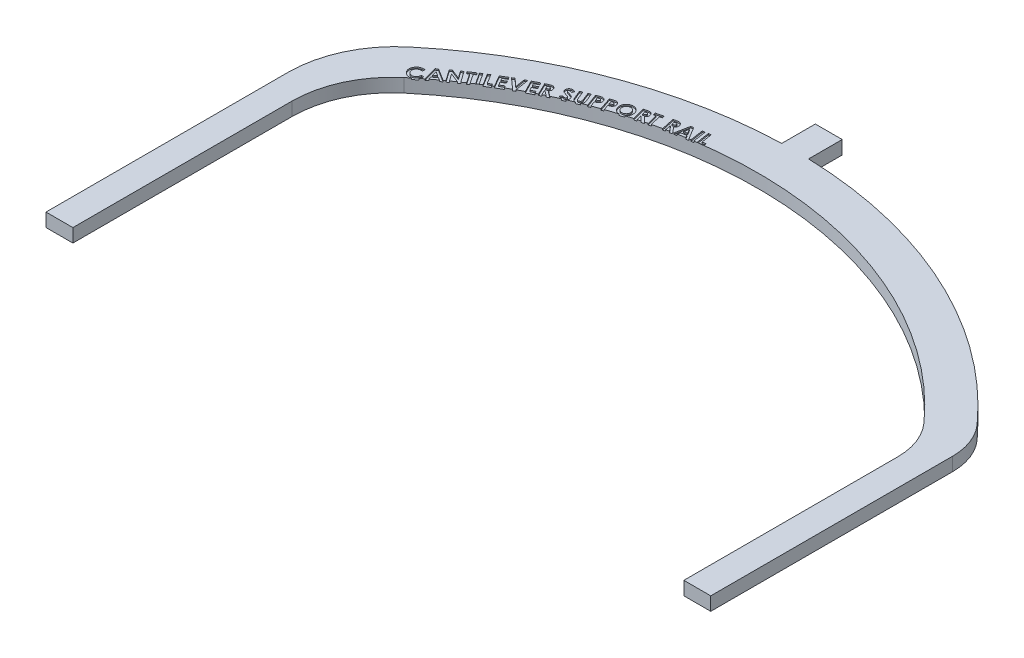
from build123d import *

# Parameters (mm, degrees)
BOSS_EXTRUDE1_DEPTH = 12.7
CUT_EXTRUDE1_DEPTH  = 1.27


with BuildPart() as part:
    # Sketch1 → Boss-Extrude1 (new body)
    with BuildSketch(Plane(origin=(0, 0, 0), x_dir=(1, 0, 0), z_dir=(0, 1, 0))):
        with BuildLine():
            Line((2401.841209368, 798.332676121), (2401.841209368, 830.082676121))
            Line((2401.841209368, 830.082676121), (2427.241209368, 830.082676121))
            Line((2427.241209368, 830.082676121), (2427.241209368, 798.332676121))
            ThreePointArc((2427.241209368, 798.332676121), (2589.753421821, 759.885508739), (2724.105617869, 660.699364075))
            ThreePointArc((2724.105617869, 660.699364075), (2734.766702642, 643.302054903), (2738.485044695, 623.239676495))
            Line((2738.485044695, 623.239676495), (2738.485044695, 394.639676495))
            Line((2738.485044695, 394.639676495), (2713.085044695, 394.639676495))
            Line((2713.085044695, 394.639676495), (2713.085044695, 596.771971598))
            ThreePointArc((2713.085044695, 596.771971598), (2709.101332249, 618.266160516), (2697.679387875, 636.905079713))
            ThreePointArc((2697.679387875, 636.905079713), (2441.118425865, 762.03822184), (2169.639130078, 673.829251519))
            ThreePointArc((2169.639130078, 673.829251519), (2144.741094815, 641.381500231), (2135.888823821, 601.451486183))
            Line((2135.888823821, 601.451486183), (2135.888823821, 394.639676495))
            Line((2135.888823821, 394.639676495), (2110.488823821, 394.639676495))
            Line((2110.488823821, 394.639676495), (2110.488823821, 623.239676495))
            ThreePointArc((2110.488823821, 623.239676495), (2120.007952658, 666.177691888), (2146.781602677, 701.069791916))
            ThreePointArc((2146.781602677, 701.069791916), (2266.118115116, 771.187102684), (2401.841209368, 798.332676121))
        make_face()
    extrude(amount=BOSS_EXTRUDE1_DEPTH)

    # Sketch2 → Cut-Extrude1 (cut)
    # profile 1 of 21: a face of its own
    with BuildSketch(Plane(origin=(0, 12.7, 0), x_dir=(1, 0, 0), z_dir=(0, 1, 0))):
        with BuildLine():
            Line((2173.231357642, 690.146919788), (2172.936245462, 687.839447833))
            add(Edge.make_bspline(
                [(2172.936245462, 687.839447833), (2172.733829883, 687.861838727), (2172.339125999, 687.905500251), (2171.754563692, 687.907062772), (2171.195838976, 687.856646991), (2170.660754262, 687.756005462), (2170.15177426, 687.599610813), (2169.667828827, 687.392491824), (2169.207758032, 687.133322769), (2168.927838013, 686.919385225), (2168.786866456, 686.811643346)],
                knots=[0, 0, 0, 0, 1.110178995, 2.164813411, 3.182023249, 4.16630837, 5.129066433, 6.080198176, 7.033161496, 8, 8, 8, 8], degree=3))
            add(Edge.make_bspline(
                [(2168.786866456, 686.811643346), (2168.673884602, 686.715313189), (2168.451734466, 686.525904389), (2168.155250513, 686.210383614), (2167.897135038, 685.876300537), (2167.677329406, 685.523433064), (2167.494155266, 685.15265157), (2167.355797235, 684.760748977), (2167.249945484, 684.351525199), (2167.185477052, 683.927951479), (2167.158601675, 683.50029347), (2167.178010706, 683.078660162), (2167.23233011, 682.666573951), (2167.332238923, 682.26466749), (2167.476958405, 681.874708911), (2167.657056303, 681.493237855), (2167.883243795, 681.124405507), (2168.060539729, 680.892625586), (2168.150848828, 680.774564019)],
                knots=[0, 0, 0, 0, 1.05173237, 2.067964735, 3.062219871, 4.039580069, 5.010003154, 5.987252451, 6.980034845, 8.001851189, 9.019433604, 10.012088621, 10.988801714, 11.961158804, 12.940457753, 13.932530269, 14.946894476, 16, 16, 16, 16], degree=3))
            add(Edge.make_bspline(
                [(2168.150848828, 680.774564019), (2168.217902851, 680.695008865), (2168.349908253, 680.538393207), (2168.559333978, 680.317930309), (2168.778314473, 680.117153414), (2169.004698622, 679.934118775), (2169.238068746, 679.767235815), (2169.478491441, 679.616790906), (2169.729136534, 679.487039264), (2169.986025279, 679.375461172), (2170.248126077, 679.280176124), (2170.514879828, 679.207763296), (2170.784045793, 679.150813217), (2171.055130396, 679.112527878), (2171.329816293, 679.094364735), (2171.606053493, 679.097909504), (2171.885784451, 679.117652151), (2172.166093484, 679.158863326), (2172.446504805, 679.217344051), (2172.72277069, 679.293386378), (2172.993897761, 679.386681227), (2173.256283125, 679.504060025), (2173.515934158, 679.631958964), (2173.769271116, 679.780721738), (2174.015450788, 679.948830458), (2174.174113183, 680.071590892), (2174.254073988, 680.13345825)],
                knots=[0, 0, 0, 0, 1.088887861, 2.143630938, 3.180177357, 4.196304021, 5.188936652, 6.181569282, 7.162183593, 8.140062349, 9.111514668, 10.07841455, 11.030658299, 11.989703728, 12.941492303, 13.909043844, 14.879157041, 15.874603407, 16.872105503, 17.875592508, 18.872146332, 19.869845871, 20.882088245, 21.900538373, 22.94193806, 24, 24, 24, 24], degree=3))
            add(Edge.make_bspline(
                [(2174.254073988, 680.13345825), (2174.384533599, 680.24536423), (2174.640813497, 680.46519666), (2174.978057679, 680.833842583), (2175.264388979, 681.22648174), (2175.468353681, 681.572719147), (2175.604260019, 681.869841703), (2175.697620628, 682.111386604), (2175.784251951, 682.372002862), (2175.863106826, 682.651123852), (2175.93083503, 682.949485723), (2175.991853861, 683.265961959), (2176.046158804, 683.601762674), (2176.072355205, 683.833256391), (2176.085804757, 683.952108089)],
                knots=[0, 0, 0, 0, 1.416939689, 2.783491055, 4.109936354, 5.420178514, 6.090036538, 6.803239493, 7.555382972, 8.354867369, 9.194857702, 10.078404074, 11.013429213, 12, 12, 12, 12], degree=3))
            Line((2176.085804757, 683.952108089), (2178.423805558, 683.654451839))
            add(Edge.make_bspline(
                [(2178.423805558, 683.654451839), (2178.403695599, 683.496563489), (2178.364243143, 683.186812324), (2178.28793995, 682.735329067), (2178.19954209, 682.307433183), (2178.097258805, 681.903502355), (2177.983447966, 681.522111388), (2177.857042292, 681.163383639), (2177.716782308, 680.828742225), (2177.563063644, 680.515197059), (2177.392319713, 680.217219626), (2177.207400984, 679.926339126), (2176.999883703, 679.643381171), (2176.773134999, 679.36646949), (2176.528405315, 679.094221724), (2176.266667153, 678.826200284), (2175.983476334, 678.566941007), (2175.784572055, 678.401019159), (2175.683841616, 678.316991903)],
                knots=[0, 0, 0, 0, 1.235582976, 2.424012065, 3.5538245, 4.626869192, 5.657909355, 6.64285172, 7.57824923, 8.473344072, 9.352017348, 10.243254057, 11.147934228, 12.074391944, 13.020822557, 13.989188457, 14.981671329, 16, 16, 16, 16], degree=3))
            add(Edge.make_bspline(
                [(2175.683841616, 678.316991903), (2175.493934769, 678.170000803), (2175.121147608, 677.881457257), (2174.528035856, 677.519124507), (2173.92743181, 677.217238281), (2173.313670548, 676.984175585), (2172.68867562, 676.818607664), (2172.052778947, 676.717039269), (2171.40631865, 676.689024784), (2170.755144059, 676.720601114), (2170.111792041, 676.820096439), (2169.486502136, 676.980333127), (2168.885837311, 677.205063303), (2168.311041628, 677.49477222), (2167.761500059, 677.845396139), (2167.237786248, 678.25796161), (2166.738156056, 678.733084585), (2166.435517037, 679.089165254), (2166.280957001, 679.271018346)],
                knots=[0, 0, 0, 0, 1.086400669, 2.132604632, 3.140358809, 4.125687137, 5.098742261, 6.062476536, 7.034796858, 8.022642088, 9.009136309, 9.976533535, 10.939839559, 11.906390961, 12.885063744, 13.885715185, 14.920218747, 16, 16, 16, 16], degree=3))
            add(Edge.make_bspline(
                [(2166.280957001, 679.271018346), (2166.185362233, 679.393750726), (2165.996667813, 679.636012054), (2165.742015032, 680.014286764), (2165.514426399, 680.398294074), (2165.318160953, 680.79031025), (2165.153536738, 681.189113762), (2165.011382537, 681.591535073), (2164.901831229, 682.002407783), (2164.824156191, 682.419325745), (2164.771895365, 682.839873295), (2164.752817073, 683.262460778), (2164.759212568, 683.685828679), (2164.798791504, 684.108955219), (2164.864060244, 684.532522462), (2164.962214193, 684.955294391), (2165.086885008, 685.379584807), (2165.241940079, 685.801385532), (2165.421033792, 686.216353906), (2165.624333014, 686.617479859), (2165.854964463, 686.999561425), (2166.106374232, 687.366400413), (2166.381664848, 687.715823894), (2166.681177143, 688.046782379), (2167.000703303, 688.364839828), (2167.232643604, 688.558534767), (2167.349466616, 688.656094468)],
                knots=[0, 0, 0, 0, 1.062251212, 2.096776656, 3.11195735, 4.109185054, 5.088010639, 6.056985029, 7.022161103, 7.988847885, 8.951500846, 9.914066686, 10.875673664, 11.841040878, 12.814212487, 13.800531958, 14.802993609, 15.832741368, 16.867801706, 17.888370809, 18.901533809, 19.913653309, 20.924047849, 21.937028728, 22.960928664, 24, 24, 24, 24], degree=3))
            add(Edge.make_bspline(
                [(2167.349466616, 688.656094468), (2167.45215523, 688.735995545), (2167.656409232, 688.894923729), (2167.976193019, 689.114677747), (2168.305742429, 689.315132904), (2168.646941016, 689.496475504), (2168.996212257, 689.661553159), (2169.356745992, 689.808229236), (2169.728428661, 689.930417028), (2170.106958588, 690.041503299), (2170.491735819, 690.129986131), (2170.880034482, 690.196045565), (2171.269795608, 690.241756037), (2171.660403097, 690.2680247), (2172.051959726, 690.269568285), (2172.444362038, 690.252447002), (2172.838466844, 690.211886713), (2173.100108572, 690.168622634), (2173.231357642, 690.146919788)],
                knots=[0, 0, 0, 0, 0.997702735, 1.984492435, 2.973850679, 3.954383721, 4.946474413, 5.935597484, 6.937193048, 7.945795584, 8.960231564, 9.963156526, 10.965089882, 11.968773709, 12.96386568, 13.966474278, 14.979909047, 16, 16, 16, 16], degree=3))
        make_face()
    # profile 2 of 21: a face of its own
    with BuildSketch(Plane(origin=(0, 12.7, 0), x_dir=(1, 0, 0), z_dir=(0, 1, 0))):
        Polygon((2176.906198846, 695.662568898), (2178.847324647, 697.125409443), (2190.295641955, 689.984203513), (2188.306178814, 688.485745981), (2185.960545801, 689.963850949), (2181.856960064, 686.870261206), (2182.597284583, 684.183722744), (2180.607821442, 682.682721142), align=None)
        Polygon((2179.90056984, 693.73925159), (2181.159884743, 689.276951911), (2183.833702852, 691.291855757), align=None, mode=Mode.SUBTRACT)
    # profile 3 of 21: a face of its own
    with BuildSketch(Plane(origin=(0, 12.7, 0), x_dir=(1, 0, 0), z_dir=(0, 1, 0))):
        Polygon((2184.654808618, 701.383039031), (2186.529788586, 702.695779415), (2195.685898361, 699.014509383), (2190.943750925, 705.786825088), (2192.90268522, 707.158079095), (2200.110036983, 696.867313871), (2198.227424804, 695.549485345), (2189.091667592, 699.215490954), (2193.821094675, 692.463527813), (2191.862160381, 691.092273806), align=None)
    # profile 4 of 21: a face of its own
    with BuildSketch(Plane(origin=(0, 12.7, 0), x_dir=(1, 0, 0), z_dir=(0, 1, 0))):
        Polygon((2194.549905881, 708.368662739), (2200.365651073, 712.217841425), (2201.670759246, 710.243642707), (2199.75507415, 708.974151521), (2205.413086971, 700.423530527), (2203.380374631, 699.080261297), (2197.72236181, 707.63088229), (2195.855014054, 706.394464021), align=None)
    # profile 5 of 21: a face of its own
    with BuildSketch(Plane(origin=(0, 12.7, 0), x_dir=(1, 0, 0), z_dir=(0, 1, 0))):
        Polygon((2201.554472328, 713.000179544), (2203.543935469, 714.31800807), (2210.507056462, 703.793188359), (2208.517593321, 702.475359833), align=None)
    # profile 6 of 21: a face of its own
    with BuildSketch(Plane(origin=(0, 12.7, 0), x_dir=(1, 0, 0), z_dir=(0, 1, 0))):
        Polygon((2206.187437416, 715.918425383), (2208.235414179, 717.177740287), (2213.6517403, 708.372712242), (2216.635935012, 710.209531152), (2217.836736294, 708.255684998), (2212.80456482, 705.159551184), align=None)
    # profile 7 of 21: a face of its own
    with BuildSketch(Plane(origin=(0, 12.7, 0), x_dir=(1, 0, 0), z_dir=(0, 1, 0))):
        Polygon((2213.126965041, 720.105756234), (2219.064825618, 723.575868413), (2220.247818407, 721.550788285), (2216.365566804, 719.281477387), (2217.515486676, 717.314910881), (2221.397738278, 719.584221778), (2222.560378503, 717.594758637), (2218.6781269, 715.32544774), (2220.349581227, 712.463368413), (2224.23183283, 714.732679311), (2225.419913759, 712.699966971), (2219.482053182, 709.229854791), align=None)
    # profile 8 of 21: a face of its own
    with BuildSketch(Plane(origin=(0, 12.7, 0), x_dir=(1, 0, 0), z_dir=(0, 1, 0))):
        Polygon((2220.444068576, 724.444758281), (2222.619248865, 725.635383281), (2229.735014089, 719.272662928), (2228.246732839, 728.716252672), (2230.421913128, 729.906877672), (2232.500418737, 716.606477031), (2230.460074185, 715.489630076), align=None)
    # profile 9 of 21: a face of its own
    with BuildSketch(Plane(origin=(0, 12.7, 0), x_dir=(1, 0, 0), z_dir=(0, 1, 0))):
        Polygon((2232.500007918, 730.933842662), (2238.628673783, 734.070681605), (2239.697183399, 731.979455643), (2235.690272341, 729.92893481), (2236.730797181, 727.898766541), (2240.737708238, 729.949287374), (2241.78840936, 727.89622247), (2237.781498302, 725.845701637), (2239.292676187, 722.892035771), (2243.299587245, 724.942556605), (2244.373185001, 722.843698432), (2238.244519136, 719.706859489), align=None)
    # profile 10 of 21: a face of its own
    with BuildSketch(Plane(origin=(0, 12.7, 0), x_dir=(1, 0, 0), z_dir=(0, 1, 0))):
        with BuildLine():
            Line((2241.080459505, 735.237166574), (2243.370122967, 736.333660965))
            add(Edge.make_bspline(
                [(2243.370122967, 736.333660965), (2243.521596616, 736.404742649), (2243.813694627, 736.541814796), (2244.24057524, 736.728493413), (2244.640030071, 736.885375399), (2245.008944955, 737.020088982), (2245.349884412, 737.123688975), (2245.660804624, 737.205117451), (2245.94408816, 737.256579203), (2246.281303991, 737.291533785), (2246.682211813, 737.279459402), (2247.149104113, 737.193164256), (2247.601361749, 737.026129075), (2247.961447872, 736.829978805), (2248.236497085, 736.638656486), (2248.435339251, 736.477852329), (2248.624780987, 736.301699903), (2248.802353211, 736.108491173), (2248.96883593, 735.898328248), (2249.123039171, 735.671445097), (2249.269417256, 735.430342919), (2249.354135855, 735.259869652), (2249.397026011, 735.173564812)],
                knots=[0, 0, 0, 0, 1.421347431, 2.740890973, 3.956872945, 5.066552961, 6.076028076, 6.982812744, 7.795303958, 8.519270897, 9.859650626, 11.1863324, 12.535414293, 13.937647829, 14.657048696, 15.379329193, 16.108189666, 16.852514192, 17.606295346, 18.383565237, 19.181653835, 20, 20, 20, 20], degree=3))
            add(Edge.make_bspline(
                [(2249.397026011, 735.173564812), (2249.438788397, 735.081589289), (2249.520934647, 734.900674232), (2249.623954097, 734.626086595), (2249.69922723, 734.353096072), (2249.755785888, 734.084689501), (2249.793497255, 733.819551666), (2249.801816649, 733.557222859), (2249.793140098, 733.29842478), (2249.758745654, 733.044207717), (2249.706684482, 732.79228466), (2249.625575723, 732.545653862), (2249.526743624, 732.30012105), (2249.404343221, 732.058334812), (2249.257985896, 731.820724509), (2249.089159251, 731.586545465), (2248.899089084, 731.35426471), (2248.757032102, 731.208046086), (2248.684686268, 731.133580837)],
                knots=[0, 0, 0, 0, 1.09685938, 2.157512906, 3.18092885, 4.168924605, 5.13535234, 6.084646377, 7.015535552, 7.94423547, 8.867255773, 9.8050891, 10.759373358, 11.739612572, 12.744166522, 13.786916756, 14.872935688, 16, 16, 16, 16], degree=3))
            Line((2248.684686268, 731.133580837), (2253.785547646, 727.37598869))
            Line((2253.785547646, 727.37598869), (2251.427194281, 726.246421382))
            Line((2251.427194281, 726.246421382), (2246.570563672, 729.825928594))
            Line((2246.570563672, 729.825928594), (2246.372126172, 729.729253914))
            Line((2246.372126172, 729.729253914), (2248.674509986, 724.926048786))
            Line((2248.674509986, 724.926048786), (2246.51459412, 723.893156158))
            Line((2246.51459412, 723.893156158), (2241.080459505, 735.237166574))
        make_face()
        with BuildLine():
            Line((2245.364674249, 731.835744299), (2246.041397005, 732.161385324))
            add(Edge.make_bspline(
                [(2246.041397005, 732.161385324), (2246.12399847, 732.202278257), (2246.282124351, 732.280560537), (2246.504043654, 732.403545713), (2246.70361036, 732.522529371), (2246.879485564, 732.641166557), (2247.029976917, 732.760410934), (2247.15549091, 732.878194193), (2247.2597128, 732.991989344), (2247.361470853, 733.144328768), (2247.443103629, 733.351256471), (2247.467715974, 733.621361438), (2247.417487933, 733.910493433), (2247.337994876, 734.097150465), (2247.295623768, 734.196641735)],
                knots=[0, 0, 0, 0, 1.204461837, 2.305728933, 3.315037427, 4.240341522, 5.076376077, 5.821267787, 6.488569286, 7.087989011, 8.207619199, 9.354564099, 10.589939122, 12, 12, 12, 12], degree=3))
            add(Edge.make_bspline(
                [(2247.295623768, 734.196641735), (2247.265211333, 734.255415065), (2247.205590613, 734.370634655), (2247.087015469, 734.521505729), (2246.950168712, 734.648163402), (2246.797164019, 734.750206034), (2246.631132419, 734.826184556), (2246.457365694, 734.87821129), (2246.275317291, 734.900976598), (2246.117705743, 734.897152855), (2245.982233772, 734.875976156), (2245.864026322, 734.850140041), (2245.730605282, 734.812052629), (2245.582281499, 734.760354774), (2245.420059503, 734.695881796), (2245.241326674, 734.622668085), (2245.048646741, 734.535371622), (2244.915162263, 734.473221511), (2244.845683864, 734.440872504)],
                knots=[0, 0, 0, 0, 1.126759185, 2.208905474, 3.252969622, 4.296031307, 5.331543593, 6.356801521, 7.377662472, 8.448438402, 9.033497815, 9.714413281, 10.511152342, 11.398580344, 12.392440594, 13.488419245, 14.692727319, 16, 16, 16, 16], degree=3))
            Line((2244.845683864, 734.440872504), (2244.252915435, 734.155936606))
            Line((2244.252915435, 734.155936606), (2245.364674249, 731.835744299))
        make_face(mode=Mode.SUBTRACT)
    # profile 11 of 21: a face of its own
    with BuildSketch(Plane(origin=(0, 12.7, 0), x_dir=(1, 0, 0), z_dir=(0, 1, 0))):
        with BuildLine():
            Line((2261.827149588, 742.866348255), (2260.822241735, 740.721696812))
            add(Edge.make_bspline(
                [(2260.822241735, 740.721696812), (2260.711416613, 740.786578794), (2260.498342315, 740.911322016), (2260.173884064, 741.056896306), (2259.867316149, 741.172631464), (2259.574628363, 741.247321642), (2259.296967605, 741.283923764), (2259.033990716, 741.286146652), (2258.785013279, 741.246639999), (2258.631073308, 741.189756122), (2258.555474908, 741.161821011)],
                knots=[0, 0, 0, 0, 1.285923329, 2.472338456, 3.558439413, 4.566258642, 5.491680341, 6.358437637, 7.193844932, 8, 8, 8, 8], degree=3))
            add(Edge.make_bspline(
                [(2258.555474908, 741.161821011), (2258.487229893, 741.12925739), (2258.355957321, 741.066619697), (2258.185207907, 740.939897611), (2258.047318321, 740.792316011), (2257.943793353, 740.627900869), (2257.875137149, 740.457566129), (2257.843207563, 740.29010581), (2257.844292906, 740.127329201), (2257.880868364, 740.028235752), (2257.899104716, 739.978828223)],
                knots=[0, 0, 0, 0, 1.211194244, 2.329790441, 3.388949082, 4.434735749, 5.430358932, 6.316451936, 7.160590829, 8, 8, 8, 8], degree=3))
            add(Edge.make_bspline(
                [(2257.899104716, 739.978828223), (2257.921984687, 739.931973085), (2257.967717209, 739.838318963), (2258.068430063, 739.715313624), (2258.188100076, 739.603696404), (2258.282938813, 739.545609442), (2258.331596703, 739.515807389)],
                knots=[0, 0, 0, 0, 0.967791811, 1.93442374, 2.940237024, 4, 4, 4, 4], degree=3))
            add(Edge.make_bspline(
                [(2258.331596703, 739.515807389), (2258.373786052, 739.494166294), (2258.471074111, 739.444262227), (2258.64266764, 739.371176125), (2258.860265669, 739.29141268), (2259.120425135, 739.197565676), (2259.424746421, 739.092800991), (2259.773428145, 738.978661874), (2260.167083734, 738.854489498), (2260.444807613, 738.769340872), (2260.590731318, 738.72460146)],
                knots=[0, 0, 0, 0, 0.474857838, 1.09501563, 1.86652153, 2.796195678, 3.865357899, 5.0902776, 6.471152436, 8, 8, 8, 8], degree=3))
            add(Edge.make_bspline(
                [(2260.590731318, 738.72460146), (2260.727230273, 738.683788501), (2260.985831121, 738.60646728), (2261.353891497, 738.498218367), (2261.678032904, 738.395981404), (2261.960965864, 738.306016056), (2262.20391774, 738.231813595), (2262.403747787, 738.161378403), (2262.564369913, 738.107766833), (2262.65579055, 738.071105388), (2262.694677632, 738.055510915)],
                knots=[0, 0, 0, 0, 1.548386444, 2.933458709, 4.169421886, 5.242096298, 6.160275906, 6.929723018, 7.544742302, 8, 8, 8, 8], degree=3))
            add(Edge.make_bspline(
                [(2262.694677632, 738.055510915), (2262.847531369, 737.99080805), (2263.14017939, 737.866930377), (2263.544794401, 737.652295841), (2263.897606397, 737.424647044), (2264.202472494, 737.17844659), (2264.465878592, 736.91002489), (2264.695394327, 736.614647053), (2264.899624043, 736.292543805), (2265.008067094, 736.059754841), (2265.06320728, 735.941388319)],
                knots=[0, 0, 0, 0, 1.218740014, 2.333353836, 3.359597961, 4.29837092, 5.20574517, 6.115361567, 7.041715329, 8, 8, 8, 8], degree=3))
            add(Edge.make_bspline(
                [(2265.06320728, 735.941388319), (2265.110189464, 735.823405354), (2265.202179297, 735.592397932), (2265.303468971, 735.23854715), (2265.361145077, 734.885854883), (2265.384295331, 734.535708192), (2265.373421965, 734.187321658), (2265.317066878, 733.841646725), (2265.229405569, 733.497412697), (2265.100462086, 733.160090828), (2264.942413277, 732.832196327), (2264.747790568, 732.524729318), (2264.52502038, 732.236387311), (2264.268707477, 731.970814143), (2263.979882397, 731.726463154), (2263.6601419, 731.502641589), (2263.311354721, 731.297100185), (2263.061314026, 731.183424942), (2262.933820261, 731.125462838)],
                knots=[0, 0, 0, 0, 1.031518925, 2.019685862, 2.983724988, 3.929791433, 4.867565412, 5.809003127, 6.770008387, 7.749100081, 8.738347573, 9.722952322, 10.700199419, 11.694378456, 12.71609211, 13.769474433, 14.86267272, 16, 16, 16, 16], degree=3))
            add(Edge.make_bspline(
                [(2262.933820261, 731.125462838), (2262.831737305, 731.083376031), (2262.629957829, 731.000186296), (2262.3229934, 730.9013001), (2262.017382491, 730.827950813), (2261.714437805, 730.77214891), (2261.412157953, 730.74648514), (2261.112082406, 730.736506311), (2260.814281812, 730.755417724), (2260.517642982, 730.796648637), (2260.220744179, 730.858988277), (2259.925199495, 730.953450887), (2259.626866627, 731.066808502), (2259.328330625, 731.208570249), (2259.028032067, 731.37362276), (2258.727445261, 731.566249649), (2258.424115142, 731.781517348), (2258.228072462, 731.941773197), (2258.128071062, 732.023519729)],
                knots=[0, 0, 0, 0, 1.021323989, 2.018772067, 2.979758655, 3.927847242, 4.865489691, 5.78376166, 6.70337339, 7.622114498, 8.553135538, 9.506081333, 10.489607957, 11.50394654, 12.560932203, 13.657928141, 14.805308807, 16, 16, 16, 16], degree=3))
            Line((2258.128071062, 732.023519729), (2259.491692857, 733.941748896))
            add(Edge.make_bspline(
                [(2259.491692857, 733.941748896), (2259.613325652, 733.850809314), (2259.846589849, 733.67640776), (2260.202741916, 733.455962147), (2260.546697242, 733.287836551), (2260.879236239, 733.173956064), (2261.198229002, 733.106601634), (2261.506789088, 733.096739696), (2261.803590713, 733.134191226), (2261.98755494, 733.202888556), (2262.079012568, 733.237041364)],
                knots=[0, 0, 0, 0, 1.293882523, 2.481374106, 3.564275724, 4.549349188, 5.470662853, 6.331206692, 7.170361108, 8, 8, 8, 8], degree=3))
            add(Edge.make_bspline(
                [(2262.079012568, 733.237041364), (2262.169100093, 733.280510166), (2262.343272625, 733.364551451), (2262.568088937, 733.540379325), (2262.755554392, 733.742197815), (2262.893133466, 733.97421754), (2262.988458922, 734.215595291), (2263.031963966, 734.458107381), (2263.017933893, 734.695222056), (2262.967002763, 734.840635307), (2262.941452472, 734.913583832)],
                knots=[0, 0, 0, 0, 1.147907326, 2.219329753, 3.262250237, 4.299725102, 5.303574411, 6.233938217, 7.11403121, 8, 8, 8, 8], degree=3))
            add(Edge.make_bspline(
                [(2262.941452472, 734.913583832), (2262.909901594, 734.977793177), (2262.84554724, 735.108761036), (2262.70119003, 735.282109128), (2262.521511845, 735.438755487), (2262.34399396, 735.557219317), (2262.173129112, 735.646291606), (2262.016173287, 735.719469569), (2261.831977895, 735.79579141), (2261.620585875, 735.874403387), (2261.380760594, 735.95482855), (2261.114102418, 736.042071963), (2260.819125836, 736.129749077), (2260.613648067, 736.18993353), (2260.506776991, 736.221236075)],
                knots=[0, 0, 0, 0, 0.90164922, 1.839094721, 2.826266732, 3.908381705, 4.526918894, 5.260585068, 6.096646716, 7.046329418, 8.110673762, 9.293674922, 10.592412834, 12, 12, 12, 12], degree=3))
            add(Edge.make_bspline(
                [(2260.506776991, 736.221236075), (2260.30218086, 736.279841337), (2259.908058028, 736.392735317), (2259.344509419, 736.567297293), (2258.833123696, 736.739948293), (2258.373685066, 736.908732099), (2257.964009839, 737.068779546), (2257.607325665, 737.229872332), (2257.299904013, 737.383019336), (2257.040754533, 737.538610601), (2256.815154907, 737.695705251), (2256.61293, 737.85818504), (2256.425675037, 738.026062604), (2256.257344017, 738.202126413), (2256.106177996, 738.385461522), (2255.974963582, 738.577413795), (2255.854544732, 738.77346838), (2255.791233396, 738.912138156), (2255.759541414, 738.981552582)],
                knots=[0, 0, 0, 0, 1.800203091, 3.467813079, 4.989914488, 6.365161938, 7.607959434, 8.709212944, 9.674836401, 10.511375378, 11.263576701, 11.998477362, 12.704415329, 13.389339833, 14.057070021, 14.711726029, 15.355124095, 16, 16, 16, 16], degree=3))
            add(Edge.make_bspline(
                [(2255.759541414, 738.981552582), (2255.720376107, 739.081818596), (2255.643171155, 739.279468851), (2255.560577809, 739.584246425), (2255.514926514, 739.890801057), (2255.502993012, 740.198553933), (2255.51937448, 740.508364804), (2255.574800057, 740.820106335), (2255.661196704, 741.133795371), (2255.781797688, 741.444491551), (2255.925587044, 741.748256209), (2256.103606376, 742.030943595), (2256.302395222, 742.295086133), (2256.526778576, 742.537920519), (2256.778115093, 742.756673025), (2257.052308049, 742.956986124), (2257.352031282, 743.135507677), (2257.566546107, 743.233785154), (2257.675226511, 743.283575819)],
                knots=[0, 0, 0, 0, 0.985718607, 1.943106389, 2.885849543, 3.818971467, 4.760625522, 5.722416556, 6.713874654, 7.736884896, 8.772386713, 9.787816365, 10.791617493, 11.797701083, 12.810690582, 13.839437623, 14.905386656, 16, 16, 16, 16], degree=3))
            add(Edge.make_bspline(
                [(2257.675226511, 743.283575819), (2257.820679741, 743.340864037), (2258.109668394, 743.454685126), (2258.564778166, 743.55665257), (2259.027991297, 743.607884614), (2259.423168461, 743.607162464), (2259.748031333, 743.573105672), (2260.007317013, 743.529514), (2260.278711221, 743.464906857), (2260.563818766, 743.383085987), (2260.862147635, 743.283983458), (2261.173169015, 743.163070335), (2261.49740272, 743.024057317), (2261.715571324, 742.919713139), (2261.827149588, 742.866348255)],
                knots=[0, 0, 0, 0, 1.300834844, 2.584518128, 3.871134084, 5.178247273, 5.86722082, 6.590861324, 7.367216959, 8.190204084, 9.06156832, 9.985296664, 10.969617558, 12, 12, 12, 12], degree=3))
        make_face()
    # profile 12 of 21: a face of its own
    with BuildSketch(Plane(origin=(0, 12.7, 0), x_dir=(1, 0, 0), z_dir=(0, 1, 0))):
        with BuildLine():
            Line((2263.683878884, 745.494463173), (2265.917572794, 746.392520064))
            Line((2265.917572794, 746.392520064), (2268.960281127, 738.823910289))
            add(Edge.make_bspline(
                [(2268.960281127, 738.823910289), (2268.991802756, 738.745586859), (2269.052520503, 738.594718316), (2269.151454144, 738.381870806), (2269.240210861, 738.185436351), (2269.332941276, 738.011008833), (2269.424406277, 737.857477437), (2269.509854194, 737.720564746), (2269.596352253, 737.606084847), (2269.707567446, 737.480826307), (2269.856363963, 737.350079536), (2270.057550793, 737.232318808), (2270.274225349, 737.136878795), (2270.511734371, 737.0798898), (2270.762867382, 737.056907352), (2271.024446147, 737.072834914), (2271.292068231, 737.129761081), (2271.467714678, 737.193534358), (2271.557777121, 737.226234007)],
                knots=[0, 0, 0, 0, 1.150814686, 2.216727933, 3.199451389, 4.089007301, 4.907914043, 5.635918424, 6.28798844, 6.861184684, 7.918346598, 8.971200786, 10.027793568, 11.135402434, 12.284706177, 13.454471515, 14.694784218, 16, 16, 16, 16], degree=3))
            add(Edge.make_bspline(
                [(2271.557777121, 737.226234007), (2271.651315738, 737.268125609), (2271.832950017, 737.349471167), (2272.080803432, 737.505228623), (2272.290944527, 737.690736069), (2272.467248002, 737.897323341), (2272.607323407, 738.118982543), (2272.704995195, 738.351570124), (2272.765550086, 738.588171042), (2272.780509061, 738.793299835), (2272.770373855, 738.968789944), (2272.745853287, 739.122537326), (2272.707653496, 739.297510747), (2272.652421076, 739.493698593), (2272.587330036, 739.712317809), (2272.504532961, 739.951973637), (2272.408514904, 740.213492118), (2272.335921378, 740.393797171), (2272.29810164, 740.487732404)],
                knots=[0, 0, 0, 0, 1.269484493, 2.46509844, 3.612178147, 4.730677556, 5.821519609, 6.848446198, 7.845288548, 8.836127108, 9.383645964, 10.021405693, 10.763655889, 11.602620998, 12.547040094, 13.590828915, 14.744871306, 16, 16, 16, 16], degree=3))
            Line((2272.29810164, 740.487732404), (2269.367332409, 747.779038494))
            Line((2269.367332409, 747.779038494), (2271.60102632, 748.677095385))
            Line((2271.60102632, 748.677095385), (2274.404592025, 741.703798109))
            add(Edge.make_bspline(
                [(2274.404592025, 741.703798109), (2274.461106108, 741.562390405), (2274.5697053, 741.290657029), (2274.717300721, 740.896245137), (2274.844740614, 740.53326232), (2274.951700505, 740.201354657), (2275.04200732, 739.90162002), (2275.111241803, 739.631821225), (2275.160723714, 739.393336784), (2275.198569758, 739.116084929), (2275.211642742, 738.782584113), (2275.176416707, 738.380012468), (2275.097638206, 737.964141059), (2274.966636624, 737.546187914), (2274.802383178, 737.134668632), (2274.586443774, 736.75349001), (2274.341714323, 736.399615465), (2274.051533199, 736.081435428), (2273.72347964, 735.790464724), (2273.347214966, 735.532026516), (2272.929963547, 735.292526924), (2272.626938314, 735.163303854), (2272.471098435, 735.096846987)],
                knots=[0, 0, 0, 0, 1.153653701, 2.216896281, 3.190150188, 4.067851274, 4.858595912, 5.56134554, 6.177468462, 6.702635559, 7.679931174, 8.69844385, 9.758108967, 10.879928467, 12.012148972, 13.107910715, 14.191608797, 15.265108626, 16.362056269, 17.506279767, 18.717529048, 20, 20, 20, 20], degree=3))
            add(Edge.make_bspline(
                [(2272.471098435, 735.096846987), (2272.366461895, 735.056347823), (2272.159447455, 734.976223691), (2271.844403397, 734.883637385), (2271.532797384, 734.810956517), (2271.223991716, 734.763367062), (2270.919015356, 734.734282679), (2270.616222827, 734.729277845), (2270.316838775, 734.746878836), (2270.021766577, 734.787510432), (2269.736262751, 734.849989715), (2269.460122162, 734.922233296), (2269.197636644, 735.013127964), (2268.950480644, 735.12526), (2268.7124616, 735.244670738), (2268.490667641, 735.387401658), (2268.279397239, 735.541211673), (2268.077720381, 735.715767353), (2267.884226444, 735.92160407), (2267.689736444, 736.16537926), (2267.496282915, 736.453717954), (2267.296584536, 736.783413719), (2267.097830515, 737.157386973), (2266.893991987, 737.573032172), (2266.687980732, 738.03129999), (2266.556003446, 738.353691615), (2266.487444589, 738.521165898)],
                knots=[0, 0, 0, 0, 1.018780023, 2.015569081, 2.979769836, 3.923255415, 4.851492571, 5.760578771, 6.67113237, 7.573141822, 8.462998318, 9.324393689, 10.164869824, 10.982188284, 11.788359392, 12.581208734, 13.374656567, 14.160892453, 14.999990785, 15.93713454, 16.990449527, 18.151664513, 19.437168079, 20.835832647, 22.356295218, 24, 24, 24, 24], degree=3))
            Line((2266.487444589, 738.521165898), (2263.683878884, 745.494463173))
        make_face()
    # profile 13 of 21: a face of its own
    with BuildSketch(Plane(origin=(0, 12.7, 0), x_dir=(1, 0, 0), z_dir=(0, 1, 0))):
        with BuildLine():
            Line((2274.521494256, 749.795015996), (2276.907832397, 750.677808464))
            add(Edge.make_bspline(
                [(2276.907832397, 750.677808464), (2277.063489079, 750.734868327), (2277.363940287, 750.845006258), (2277.804073774, 750.986497588), (2278.213671463, 751.10663863), (2278.593246864, 751.205298916), (2278.944163332, 751.276258418), (2279.265032585, 751.325878976), (2279.556462177, 751.352306363), (2279.822985548, 751.356869506), (2280.070935384, 751.333689542), (2280.309729755, 751.300329856), (2280.541005664, 751.241917309), (2280.768593204, 751.172905327), (2280.987983068, 751.079187553), (2281.20201939, 750.970565021), (2281.408734482, 750.841711747), (2281.609947477, 750.698066851), (2281.799157417, 750.534069076), (2281.982209333, 750.359172391), (2282.149174204, 750.164028734), (2282.307491775, 749.955797527), (2282.453377004, 749.73068707), (2282.584210727, 749.489219617), (2282.705476466, 749.232905086), (2282.774716564, 749.05430973), (2282.810075987, 748.963104938)],
                knots=[0, 0, 0, 0, 1.686368885, 3.255058277, 4.701955097, 6.028501221, 7.243265888, 8.342538964, 9.329777341, 10.218385687, 11.049434788, 11.86077241, 12.668432562, 13.473323585, 14.277613374, 15.091698196, 15.91288273, 16.753282263, 17.603848555, 18.457951157, 19.32631211, 20.213159921, 21.117664584, 22.051957786, 23.005176902, 24, 24, 24, 24], degree=3))
            add(Edge.make_bspline(
                [(2282.810075987, 748.963104938), (2282.845723359, 748.861863873), (2282.915956263, 748.66239745), (2282.989796579, 748.359627644), (2283.04625656, 748.064421492), (2283.070267032, 747.773830606), (2283.074100121, 747.488812832), (2283.051192854, 747.208548799), (2283.002541947, 746.934315599), (2282.928594953, 746.667066623), (2282.830830742, 746.408595957), (2282.71751096, 746.156870414), (2282.57820214, 745.918706849), (2282.423544682, 745.687137675), (2282.243943078, 745.469752263), (2282.047651996, 745.258894883), (2281.828623447, 745.061197292), (2281.671132013, 744.939093126), (2281.591466211, 744.877327695)],
                knots=[0, 0, 0, 0, 1.116512027, 2.19976607, 3.240318441, 4.241645183, 5.230286479, 6.204479212, 7.163721604, 8.125235547, 9.086019934, 10.037883271, 10.9947673, 11.954456313, 12.933236888, 13.926124674, 14.950946487, 16, 16, 16, 16], degree=3))
            add(Edge.make_bspline(
                [(2281.591466211, 744.877327695), (2281.537607714, 744.840221416), (2281.42049562, 744.759536025), (2281.221368737, 744.643637723), (2280.986185216, 744.52244672), (2280.716876921, 744.392417578), (2280.410612504, 744.25862532), (2280.06958119, 744.116356565), (2279.693499313, 743.965779849), (2279.429234821, 743.867583367), (2279.291626468, 743.816450291)],
                knots=[0, 0, 0, 0, 0.618127389, 1.344081192, 2.175978237, 3.119002851, 4.170673796, 5.334963185, 6.612256508, 8, 8, 8, 8], degree=3))
            Line((2279.291626468, 743.816450291), (2281.14116573, 738.814807663))
            Line((2281.14116573, 738.814807663), (2278.892207397, 737.982896605))
            Line((2278.892207397, 737.982896605), (2274.521494256, 749.795015996))
        make_face()
        with BuildLine():
            Line((2278.480067974, 746.009439073), (2279.194951788, 746.274022406))
            add(Edge.make_bspline(
                [(2279.194951788, 746.274022406), (2279.324406882, 746.322637159), (2279.561887775, 746.411819241), (2279.879448508, 746.553573486), (2280.127475118, 746.686982696), (2280.317741018, 746.813467469), (2280.452769706, 746.951085258), (2280.5600413, 747.093388129), (2280.642112893, 747.24850076), (2280.695339367, 747.41660908), (2280.724019744, 747.593285309), (2280.722863813, 747.777664945), (2280.695846287, 747.968572191), (2280.653932429, 748.092715239), (2280.632351628, 748.156634586)],
                knots=[0, 0, 0, 0, 1.830136425, 3.357321966, 4.598017425, 5.557100676, 6.366663034, 7.136663688, 7.909848369, 8.676569619, 9.460836761, 10.268997278, 11.108733305, 12, 12, 12, 12], degree=3))
            add(Edge.make_bspline(
                [(2280.632351628, 748.156634586), (2280.610874398, 748.211573255), (2280.56945482, 748.317524371), (2280.485612011, 748.461803529), (2280.392232674, 748.590271383), (2280.284381516, 748.699790238), (2280.165855061, 748.794283008), (2280.032739734, 748.866784348), (2279.888585202, 748.924787963), (2279.786458629, 748.946782497), (2279.734294737, 748.958016797)],
                knots=[0, 0, 0, 0, 1.11764165, 2.155410389, 3.156224186, 4.123360966, 5.063210716, 6.021203061, 6.989276277, 8, 8, 8, 8], degree=3))
            add(Edge.make_bspline(
                [(2279.734294737, 748.958016797), (2279.691975718, 748.964178713), (2279.601756665, 748.977315175), (2279.455728402, 748.974910393), (2279.293244501, 748.959789095), (2279.112900228, 748.926503276), (2278.913258632, 748.885735202), (2278.697188944, 748.821578314), (2278.462366616, 748.749082395), (2278.301744834, 748.690758815), (2278.218028711, 748.660360547)],
                knots=[0, 0, 0, 0, 0.656932028, 1.400499986, 2.239044201, 3.165518444, 4.219668417, 5.371850055, 6.630207433, 8, 8, 8, 8], degree=3))
            Line((2278.218028711, 748.660360547), (2277.584555153, 748.42630606))
            Line((2277.584555153, 748.42630606), (2278.480067974, 746.009439073))
        make_face(mode=Mode.SUBTRACT)
    # profile 14 of 21: a face of its own
    with BuildSketch(Plane(origin=(0, 12.7, 0), x_dir=(1, 0, 0), z_dir=(0, 1, 0))):
        with BuildLine():
            Line((2283.980936523, 753.274029229), (2286.390171299, 754.098308075))
            add(Edge.make_bspline(
                [(2286.390171299, 754.098308075), (2286.547603762, 754.150983056), (2286.851093725, 754.252527093), (2287.295210515, 754.384245855), (2287.707595531, 754.497612561), (2288.091337202, 754.584763087), (2288.443591266, 754.648791016), (2288.766203541, 754.690870815), (2289.05863291, 754.70992336), (2289.32583758, 754.705273071), (2289.57417248, 754.679230619), (2289.811069625, 754.635197256), (2290.042344424, 754.577659262), (2290.265835034, 754.498154757), (2290.483333723, 754.400677512), (2290.694604591, 754.286415178), (2290.89862979, 754.153511192), (2291.095068249, 754.002913797), (2291.281586729, 753.835746874), (2291.45966886, 753.654704923), (2291.620411625, 753.454710793), (2291.775901002, 753.244265486), (2291.911765752, 753.013206874), (2292.0381922, 752.769122766), (2292.158219361, 752.511820529), (2292.221849611, 752.330785886), (2292.254253831, 752.23859253)],
                knots=[0, 0, 0, 0, 1.687184391, 3.252464711, 4.707680245, 6.033356432, 7.250648261, 8.345388057, 9.33843026, 10.226374883, 11.058294833, 11.873162291, 12.673820267, 13.477996413, 14.28050798, 15.094280677, 15.91668034, 16.752786862, 17.607435755, 18.460779773, 19.330422137, 20.213164243, 21.117810442, 22.050756386, 23.007331922, 24, 24, 24, 24], degree=3))
            add(Edge.make_bspline(
                [(2292.254253831, 752.23859253), (2292.287258482, 752.135587952), (2292.351853576, 751.933992412), (2292.419333132, 751.629875452), (2292.466688783, 751.333515454), (2292.488222864, 751.042331763), (2292.479302139, 750.756278596), (2292.448878261, 750.476430765), (2292.397110083, 750.2021369), (2292.31311659, 749.937849945), (2292.212304341, 749.680490729), (2292.089335855, 749.433088473), (2291.947520913, 749.195709102), (2291.781887075, 748.971828861), (2291.602776455, 748.753446184), (2291.397944721, 748.551447206), (2291.175093214, 748.358639266), (2291.015272188, 748.240807456), (2290.933881235, 748.180800062)],
                knots=[0, 0, 0, 0, 1.124528991, 2.200873346, 3.236321832, 4.24435652, 5.232631164, 6.208666518, 7.17048876, 8.130286537, 9.088502263, 10.043138597, 11.00070452, 11.960502297, 12.937414127, 13.935364336, 14.948557214, 16, 16, 16, 16], degree=3))
            add(Edge.make_bspline(
                [(2290.933881235, 748.180800062), (2290.87936831, 748.144164918), (2290.760878516, 748.064534434), (2290.555356693, 747.959119657), (2290.318372901, 747.841197813), (2290.046233552, 747.715545194), (2289.735431956, 747.591456473), (2289.391375016, 747.454561728), (2289.010756727, 747.316260906), (2288.744405428, 747.223877947), (2288.606056716, 747.17589221)],
                knots=[0, 0, 0, 0, 0.619743065, 1.34707921, 2.177965391, 3.12041775, 4.176285136, 5.337721592, 6.617154139, 8, 8, 8, 8], degree=3))
            Line((2288.606056716, 747.17589221), (2290.336024664, 742.123368171))
            Line((2290.336024664, 742.123368171), (2288.064169696, 741.344882594))
            Line((2288.064169696, 741.344882594), (2283.980936523, 753.274029229))
        make_face()
        with BuildLine():
            Line((2287.847923703, 749.389233556), (2288.570439728, 749.636008395))
            add(Edge.make_bspline(
                [(2288.570439728, 749.636008395), (2288.700665552, 749.682241303), (2288.940149137, 749.767263014), (2289.260935931, 749.900931779), (2289.514272169, 750.025536214), (2289.704369279, 750.151364794), (2289.847430892, 750.282365607), (2289.956849475, 750.42330801), (2290.043692338, 750.576150031), (2290.10131499, 750.742648115), (2290.134944789, 750.919197552), (2290.140064843, 751.103902845), (2290.113646669, 751.295130552), (2290.075753724, 751.420682927), (2290.056176908, 751.485547658)],
                knots=[0, 0, 0, 0, 1.826165971, 3.358295321, 4.591438027, 5.552042891, 6.361078696, 7.143591845, 7.901308757, 8.674128965, 9.461124631, 10.268450493, 11.10542121, 12, 12, 12, 12], degree=3))
            add(Edge.make_bspline(
                [(2290.056176908, 751.485547658), (2290.035007966, 751.540171837), (2289.993828542, 751.64643091), (2289.919203807, 751.79560273), (2289.825207795, 751.924135777), (2289.721201616, 752.036177785), (2289.605250077, 752.133428383), (2289.473959824, 752.207696266), (2289.332935481, 752.272651066), (2289.230805305, 752.295549171), (2289.178472581, 752.307282434)],
                knots=[0, 0, 0, 0, 1.112771927, 2.164647914, 3.157121701, 4.125912928, 5.064364492, 6.017494183, 6.984140284, 8, 8, 8, 8], degree=3))
            add(Edge.make_bspline(
                [(2289.178472581, 752.307282434), (2289.136173783, 752.314049406), (2289.046090695, 752.328460922), (2288.899999989, 752.333422896), (2288.737165011, 752.317173516), (2288.554739496, 752.296541107), (2288.355820422, 752.253449278), (2288.137558291, 752.200040099), (2287.901563611, 752.131340645), (2287.739170687, 752.076405134), (2287.654574344, 752.047787242)],
                knots=[0, 0, 0, 0, 0.658258816, 1.401883501, 2.238859633, 3.171966861, 4.222883335, 5.364436582, 6.627039768, 8, 8, 8, 8], degree=3))
            Line((2287.654574344, 752.047787242), (2287.013468575, 751.828997177))
            Line((2287.013468575, 751.828997177), (2287.847923703, 749.389233556))
        make_face(mode=Mode.SUBTRACT)
    # profile 15 of 21: a face of its own
    with BuildSketch(Plane(origin=(0, 12.7, 0), x_dir=(1, 0, 0), z_dir=(0, 1, 0))):
        with BuildLine():
            add(Edge.make_bspline(
                [(2299.249607146, 758.550171911), (2299.460641956, 758.608644338), (2299.876975587, 758.723999895), (2300.512424122, 758.822553216), (2301.142280669, 758.855738387), (2301.768260796, 758.825922143), (2302.387871614, 758.727934568), (2303.003386965, 758.566461819), (2303.612636549, 758.337792156), (2304.21029091, 758.049940491), (2304.781681742, 757.709731011), (2305.311047633, 757.321603919), (2305.792057699, 756.890606491), (2306.220934306, 756.414995725), (2306.600828773, 755.897025062), (2306.92828166, 755.33550223), (2307.209268096, 754.731853162), (2307.351457429, 754.306529077), (2307.423705703, 754.090416302)],
                knots=[0, 0, 0, 0, 1.014422571, 2.001272827, 2.973555327, 3.933860434, 4.900684367, 5.876068937, 6.878586004, 7.91238956, 8.947209008, 9.956722456, 10.950438384, 11.93568238, 12.920047703, 13.922557063, 14.944423853, 16, 16, 16, 16], degree=3))
            add(Edge.make_bspline(
                [(2307.423705703, 754.090416302), (2307.484964539, 753.872649594), (2307.605351852, 753.444689314), (2307.707375844, 752.793706439), (2307.750715798, 752.152300671), (2307.724228745, 751.517974744), (2307.635032666, 750.891451491), (2307.480865836, 750.272904729), (2307.264187629, 749.662146156), (2306.981748362, 749.068966393), (2306.650109664, 748.503557157), (2306.271589655, 747.981454877), (2305.852662374, 747.507291015), (2305.390523303, 747.083541575), (2304.886673282, 746.709877849), (2304.340338802, 746.388487695), (2303.75367121, 746.113435566), (2303.339469952, 745.974227868), (2303.129314678, 745.903597392)],
                knots=[0, 0, 0, 0, 1.054003203, 2.071351998, 3.065852522, 4.047273139, 5.025869885, 6.011741124, 7.014765524, 8.042428094, 9.070501367, 10.067067136, 11.044632817, 12.015747649, 12.985315632, 13.963872434, 14.966920216, 16, 16, 16, 16], degree=3))
            add(Edge.make_bspline(
                [(2303.129314678, 745.903597392), (2302.906442678, 745.84161875), (2302.468257942, 745.719763627), (2301.803175999, 745.613553557), (2301.149466406, 745.57449166), (2300.50576046, 745.60258482), (2299.872648804, 745.696203826), (2299.250709789, 745.860170409), (2298.641517435, 746.095163648), (2298.049239607, 746.390832392), (2297.485802878, 746.738483203), (2296.966945487, 747.132200778), (2296.4965026, 747.56378713), (2296.07352008, 748.033430078), (2295.703725666, 748.545465384), (2295.38279112, 749.095283268), (2295.105957297, 749.682506595), (2294.96879517, 750.097141283), (2294.899246569, 750.307383449)],
                knots=[0, 0, 0, 0, 1.067024635, 2.097858459, 3.101562794, 4.08492151, 5.06633876, 6.049876614, 7.047180646, 8.074665254, 9.101098193, 10.098402225, 11.076254029, 12.043584047, 13.010470532, 13.985843898, 14.978714146, 16, 16, 16, 16], degree=3))
            add(Edge.make_bspline(
                [(2294.899246569, 750.307383449), (2294.85849046, 750.451095609), (2294.777794549, 750.735641508), (2294.688224594, 751.167279199), (2294.631109023, 751.598486498), (2294.59631355, 752.028180422), (2294.59363507, 752.457639177), (2294.623554885, 752.88564986), (2294.675077222, 753.314430374), (2294.760642599, 753.73958309), (2294.867866695, 754.159426553), (2295.007357955, 754.566175142), (2295.166135366, 754.962811451), (2295.356182577, 755.343853996), (2295.567355364, 755.714090959), (2295.803435925, 756.071735077), (2296.071002275, 756.411837606), (2296.355416338, 756.742094992), (2296.663256705, 757.051305437), (2296.986910547, 757.339317256), (2297.325356685, 757.605764386), (2297.681552919, 757.84280275), (2298.049704982, 758.059754229), (2298.435249165, 758.246535709), (2298.834892137, 758.413783181), (2299.110716637, 758.504494519), (2299.249607146, 758.550171911)],
                knots=[0, 0, 0, 0, 1.037733281, 2.054681743, 3.059678619, 4.058437524, 5.048379698, 6.040424034, 7.03805248, 8.046894087, 9.051614543, 10.046646787, 11.032529679, 12.018095561, 13.002568739, 13.992931702, 14.992420376, 16.007369576, 17.019852726, 18.021527519, 19.016367828, 20.010003339, 20.992322808, 21.983176467, 22.984435223, 24, 24, 24, 24], degree=3))
        make_face()
        with BuildLine():
            add(Edge.make_bspline(
                [(2299.908521408, 756.298669507), (2299.772554515, 756.254098634), (2299.505609389, 756.166592205), (2299.129665384, 755.987028306), (2298.779526586, 755.78163328), (2298.456365562, 755.543806613), (2298.162809123, 755.272639242), (2297.897347063, 754.969895814), (2297.656664722, 754.638951155), (2297.45040532, 754.277956161), (2297.274607987, 753.900131713), (2297.141632174, 753.507570222), (2297.049672387, 753.106108327), (2296.99809452, 752.695283552), (2296.991452715, 752.275813301), (2297.025761127, 751.848506943), (2297.09812709, 751.410994868), (2297.180119014, 751.121660181), (2297.221982947, 750.973929924)],
                knots=[0, 0, 0, 0, 1.029163222, 2.020566178, 2.992222631, 3.94831456, 4.903158175, 5.863431781, 6.842844339, 7.843937269, 8.851950043, 9.838510101, 10.821891484, 11.812372912, 12.813782264, 13.836423968, 14.895308241, 16, 16, 16, 16], degree=3))
            add(Edge.make_bspline(
                [(2297.221982947, 750.973929924), (2297.275385136, 750.81316304), (2297.380013546, 750.498180011), (2297.592037367, 750.056975567), (2297.834269942, 749.651619319), (2298.120337222, 749.290509134), (2298.440044673, 748.967514915), (2298.796181333, 748.683161393), (2299.190247278, 748.437994507), (2299.475989861, 748.312788673), (2299.62104144, 748.249230404)],
                knots=[0, 0, 0, 0, 1.080117982, 2.116224609, 3.116767515, 4.087928241, 5.048460286, 6.011139625, 6.99039431, 8, 8, 8, 8], degree=3))
            add(Edge.make_bspline(
                [(2299.62104144, 748.249230404), (2299.73647035, 748.204572062), (2299.964981518, 748.116163274), (2300.317601872, 748.024238148), (2300.670293746, 747.958412077), (2301.024757823, 747.928903406), (2301.380484696, 747.92874717), (2301.738078852, 747.959275708), (2302.097436591, 748.02246421), (2302.333505717, 748.088642781), (2302.452591921, 748.122026879)],
                knots=[0, 0, 0, 0, 1.026165378, 2.031468983, 3.018282211, 3.99996466, 4.978009176, 5.966702026, 6.974293071, 8, 8, 8, 8], degree=3))
            add(Edge.make_bspline(
                [(2302.452591921, 748.122026879), (2302.58504601, 748.166023618), (2302.846478489, 748.252862587), (2303.216505693, 748.427403026), (2303.559207453, 748.634906311), (2303.87705842, 748.872598795), (2304.16869476, 749.143117511), (2304.430706023, 749.44850134), (2304.669385929, 749.782959527), (2304.874679872, 750.147300137), (2305.050466505, 750.528682152), (2305.186155489, 750.922410956), (2305.280295144, 751.323013249), (2305.335240961, 751.729501549), (2305.343330345, 752.14124988), (2305.316274295, 752.558749238), (2305.244645024, 752.98311897), (2305.166300548, 753.263367623), (2305.12641003, 753.406061334)],
                knots=[0, 0, 0, 0, 1.014620638, 2.002616843, 2.968564783, 3.924771424, 4.88508858, 5.856007716, 6.847099919, 7.869381001, 8.893558951, 9.898285211, 10.893362953, 11.882764134, 12.876291716, 13.884138105, 14.922670338, 16, 16, 16, 16], degree=3))
            add(Edge.make_bspline(
                [(2305.12641003, 753.406061334), (2305.079931186, 753.54617287), (2304.988739644, 753.821071858), (2304.807462803, 754.210338515), (2304.598438403, 754.573238156), (2304.359926384, 754.911182671), (2304.085247155, 755.217538373), (2303.780313749, 755.496113068), (2303.446028688, 755.748915512), (2303.084628459, 755.970910363), (2302.705485266, 756.157893608), (2302.318390575, 756.307020452), (2301.925966635, 756.411735406), (2301.529750354, 756.476510334), (2301.128690037, 756.496937486), (2300.723997517, 756.472377839), (2300.314589069, 756.409994727), (2300.045286735, 756.336164318), (2299.908521408, 756.298669507)],
                knots=[0, 0, 0, 0, 1.065795186, 2.091091337, 3.09575002, 4.088606909, 5.073663464, 6.062390614, 7.068430837, 8.09718105, 9.121964498, 10.118745737, 11.089232515, 12.051172006, 13.014339966, 13.983956048, 14.976151064, 16, 16, 16, 16], degree=3))
        make_face(mode=Mode.SUBTRACT)
    # profile 16 of 21: a face of its own
    with BuildSketch(Plane(origin=(0, 12.7, 0), x_dir=(1, 0, 0), z_dir=(0, 1, 0))):
        with BuildLine():
            Line((2308.387113541, 760.958625105), (2310.842141586, 761.620083438))
            add(Edge.make_bspline(
                [(2310.842141586, 761.620083438), (2311.004769191, 761.662402004), (2311.317309015, 761.743730369), (2311.771840589, 761.848954017), (2312.192717442, 761.932558612), (2312.580943038, 761.998434294), (2312.936024186, 762.03887935), (2313.257791876, 762.060161757), (2313.546167825, 762.062657687), (2313.805623666, 762.038831627), (2314.045365357, 761.997173531), (2314.275029937, 761.938456791), (2314.498912253, 761.862328126), (2314.715996604, 761.768021329), (2314.92441368, 761.655151651), (2315.127915825, 761.52755631), (2315.32322457, 761.37886442), (2315.513258197, 761.2145756), (2315.693449374, 761.034994797), (2315.859735635, 760.839894397), (2316.013148241, 760.631434172), (2316.149611768, 760.406464035), (2316.274691397, 760.169490263), (2316.386747223, 759.918820101), (2316.487294178, 759.654298432), (2316.539673421, 759.469934204), (2316.56630024, 759.376213246)],
                knots=[0, 0, 0, 0, 1.709112876, 3.284595109, 4.744391745, 6.073032786, 7.288417661, 8.377378103, 9.352022945, 10.218026655, 11.023453662, 11.824667017, 12.626576454, 13.426163261, 14.22881452, 15.035210781, 15.866679498, 16.722703733, 17.588750394, 18.451311078, 19.32769004, 20.218215925, 21.124885587, 22.051439831, 23.009455754, 24, 24, 24, 24], degree=3))
            add(Edge.make_bspline(
                [(2316.56630024, 759.376213246), (2316.59162373, 759.278181612), (2316.641473011, 759.085206375), (2316.687790533, 758.7956176), (2316.717925967, 758.513650543), (2316.722225986, 758.239651096), (2316.707324176, 757.972575234), (2316.671612764, 757.713110502), (2316.616440977, 757.459808449), (2316.536303993, 757.215189907), (2316.437544621, 756.976935372), (2316.314049741, 756.748008826), (2316.171482159, 756.525097674), (2316.005008678, 756.31173324), (2315.817869877, 756.104401433), (2315.610046913, 755.904120337), (2315.379007241, 755.711936473), (2315.213612371, 755.593026189), (2315.1289004, 755.532122701)],
                knots=[0, 0, 0, 0, 1.098258433, 2.161921341, 3.179347557, 4.173488046, 5.132235987, 6.079786748, 7.013152153, 7.941604117, 8.869736719, 9.80848623, 10.760718484, 11.738233306, 12.741786689, 13.789725228, 14.86794112, 16, 16, 16, 16], degree=3))
            Line((2315.1289004, 755.532122701), (2319.466540624, 750.899370297))
            Line((2319.466540624, 750.899370297), (2316.935190464, 750.215015329))
            Line((2316.935190464, 750.215015329), (2312.808708092, 754.628977669))
            Line((2312.808708092, 754.628977669), (2312.595006169, 754.573008117))
            Line((2312.595006169, 754.573008117), (2313.984068669, 749.421265329))
            Line((2313.984068669, 749.421265329), (2311.668964503, 748.795423983))
            Line((2311.668964503, 748.795423983), (2308.387113541, 760.958625105))
        make_face()
        with BuildLine():
            Line((2311.984429246, 756.829598662), (2312.712033413, 757.025492092))
            add(Edge.make_bspline(
                [(2312.712033413, 757.025492092), (2312.800372266, 757.050414124), (2312.970267484, 757.098344721), (2313.212274546, 757.175545797), (2313.428285492, 757.261291626), (2313.622843121, 757.342981835), (2313.792411097, 757.432214773), (2313.936524204, 757.526910819), (2314.061609507, 757.619440899), (2314.190110212, 757.751622067), (2314.308937452, 757.940170839), (2314.383688501, 758.201450355), (2314.389536726, 758.495152215), (2314.344057481, 758.69336321), (2314.319885977, 758.798709239)],
                knots=[0, 0, 0, 0, 1.198485456, 2.304953479, 3.314550584, 4.231960346, 5.059138579, 5.811575419, 6.482623364, 7.085537457, 8.209921151, 9.352154179, 10.592711542, 12, 12, 12, 12], degree=3))
            add(Edge.make_bspline(
                [(2314.319885977, 758.798709239), (2314.300931789, 758.862373065), (2314.263849149, 758.986927207), (2314.170931619, 759.155543564), (2314.06306821, 759.308452925), (2313.927912445, 759.435616134), (2313.779066495, 759.541872766), (2313.616901408, 759.625974923), (2313.440639955, 759.678004193), (2313.284540471, 759.704447992), (2313.147072845, 759.711365343), (2313.026276569, 759.705359194), (2312.88894649, 759.68901183), (2312.734539142, 759.666125373), (2312.562935577, 759.635781935), (2312.375065937, 759.593787132), (2312.168526578, 759.546384101), (2312.025864639, 759.508130911), (2311.95135633, 759.488152348)],
                knots=[0, 0, 0, 0, 1.127715307, 2.206301792, 3.26035508, 4.301875062, 5.347489832, 6.367676739, 7.395192963, 8.463292402, 9.055943257, 9.735130734, 10.519566053, 11.409801779, 12.392522499, 13.485602765, 14.686801207, 16, 16, 16, 16], degree=3))
            Line((2311.95135633, 759.488152348), (2311.315338701, 759.317699624))
            Line((2311.315338701, 759.317699624), (2311.984429246, 756.829598662))
        make_face(mode=Mode.SUBTRACT)
    # profile 17 of 21: a face of its own
    with BuildSketch(Plane(origin=(0, 12.7, 0), x_dir=(1, 0, 0), z_dir=(0, 1, 0))):
        Polygon((2317.199485037, 763.38228104), (2323.987065165, 765.048647226), (2324.551848819, 762.743719342), (2322.315610838, 762.196744181), (2324.765550742, 752.221443701), (2322.394477024, 751.638851553), (2319.94453712, 761.614152034), (2317.764268691, 761.077353156), align=None)
    # profile 18 of 21: a face of its own
    with BuildSketch(Plane(origin=(0, 12.7, 0), x_dir=(1, 0, 0), z_dir=(0, 1, 0))):
        with BuildLine():
            Line((2330.88162996, 766.620929939), (2333.384995345, 767.145008465))
            add(Edge.make_bspline(
                [(2333.384995345, 767.145008465), (2333.550200342, 767.178087754), (2333.868929511, 767.241907461), (2334.331350631, 767.320219183), (2334.759465052, 767.383012639), (2335.153268446, 767.424034222), (2335.512394228, 767.445713614), (2335.83687752, 767.445843845), (2336.126853007, 767.429668676), (2336.387169386, 767.393657346), (2336.626609817, 767.33984171), (2336.85280173, 767.264502731), (2337.072870865, 767.17605912), (2337.284771632, 767.06873367), (2337.487929242, 766.943130645), (2337.686104339, 766.803376317), (2337.872943418, 766.641957158), (2338.053844454, 766.466854711), (2338.224625017, 766.276791731), (2338.379668054, 766.070330227), (2338.51859613, 765.85055825), (2338.648717565, 765.620328904), (2338.758424823, 765.3742087), (2338.855988348, 765.116175184), (2338.937724056, 764.844827718), (2338.98049379, 764.658029499), (2339.002303037, 764.562776895)],
                knots=[0, 0, 0, 0, 1.704041191, 3.287598102, 4.743218962, 6.079769274, 7.29111761, 8.380438288, 9.360095339, 10.226193149, 11.035603938, 11.838489506, 12.634888769, 13.432764726, 14.237435147, 15.049069783, 15.882660766, 16.731859574, 17.594467614, 18.464210383, 19.339812342, 20.222902327, 21.136498512, 22.06209516, 23.01181883, 24, 24, 24, 24], degree=3))
            add(Edge.make_bspline(
                [(2339.002303037, 764.562776895), (2339.021392346, 764.462922214), (2339.058914506, 764.266646728), (2339.092378324, 763.973372769), (2339.102261914, 763.688459679), (2339.092422093, 763.412091902), (2339.062289359, 763.144893088), (2339.01094095, 762.886302816), (2338.940178508, 762.635548107), (2338.845606279, 762.394023872), (2338.730130496, 762.1611347), (2338.595373838, 761.936988223), (2338.438919228, 761.721473538), (2338.259715436, 761.516054628), (2338.061527843, 761.316142388), (2337.838297445, 761.129110358), (2337.597448141, 760.947093776), (2337.424129778, 760.837867716), (2337.335936851, 760.782288112)],
                knots=[0, 0, 0, 0, 1.096208829, 2.154720443, 3.179747431, 4.168213809, 5.134815667, 6.076518545, 7.008712861, 7.941176352, 8.869684137, 9.809252639, 10.758740511, 11.737896167, 12.746800717, 13.791430785, 14.876171114, 16, 16, 16, 16], degree=3))
            Line((2337.335936851, 760.782288112), (2341.421714095, 755.884952375))
            Line((2341.421714095, 755.884952375), (2338.844570665, 755.348153497))
            Line((2338.844570665, 755.348153497), (2334.957230922, 760.013978818))
            Line((2334.957230922, 760.013978818), (2334.738440858, 759.968185548))
            Line((2334.738440858, 759.968185548), (2335.834935249, 754.71722401))
            Line((2335.834935249, 754.71722401), (2333.474037813, 754.22367433))
            Line((2333.474037813, 754.22367433), (2330.88162996, 766.620929939))
        make_face()
        with BuildLine():
            Line((2334.257611531, 762.268025292), (2334.99793605, 762.423213593))
            add(Edge.make_bspline(
                [(2334.99793605, 762.423213593), (2335.088004826, 762.442817941), (2335.261297968, 762.480536883), (2335.508267571, 762.546892356), (2335.732010011, 762.616947433), (2335.930526986, 762.693305349), (2336.10588051, 762.772546546), (2336.25844732, 762.854945585), (2336.38741281, 762.943636218), (2336.523195843, 763.068934415), (2336.653496498, 763.250022446), (2336.7402969, 763.507703804), (2336.766095745, 763.800960363), (2336.731210715, 764.002592785), (2336.712639575, 764.109932343)],
                knots=[0, 0, 0, 0, 1.197802791, 2.304583429, 3.322347693, 4.243381808, 5.067017561, 5.821699086, 6.494345359, 7.094867052, 8.217177433, 9.349990767, 10.589260506, 12, 12, 12, 12], degree=3))
            add(Edge.make_bspline(
                [(2336.712639575, 764.109932343), (2336.697027379, 764.175102476), (2336.66661779, 764.302041492), (2336.584893647, 764.477178761), (2336.482555706, 764.634418001), (2336.357939726, 764.771866383), (2336.21402021, 764.886719609), (2336.056291334, 764.98008917), (2335.882450803, 765.042545323), (2335.72787642, 765.078312454), (2335.590085233, 765.091199841), (2335.467700776, 765.093042988), (2335.328449884, 765.087727999), (2335.171540454, 765.074077947), (2334.997297847, 765.054927398), (2334.805429515, 765.021562901), (2334.595178182, 764.988554728), (2334.449985626, 764.957802233), (2334.374638774, 764.941843401)],
                knots=[0, 0, 0, 0, 1.132381948, 2.205664557, 3.253273345, 4.300488295, 5.332226312, 6.361863128, 7.388892503, 8.448150992, 9.039771779, 9.72927765, 10.51968713, 11.398682101, 12.396269977, 13.487089175, 14.69593922, 16, 16, 16, 16], degree=3))
            Line((2334.374638774, 764.941843401), (2333.725900793, 764.804463593))
            Line((2333.725900793, 764.804463593), (2334.257611531, 762.268025292))
        make_face(mode=Mode.SUBTRACT)
    # profile 19 of 21: a face of its own
    with BuildSketch(Plane(origin=(0, 12.7, 0), x_dir=(1, 0, 0), z_dir=(0, 1, 0))):
        Polygon((2344.949556023, 769.298720296), (2347.340982305, 769.721036001), (2354.296471087, 758.163323661), (2351.843987112, 757.730831674), (2350.424395766, 760.114625744), (2345.369327657, 759.224201065), (2344.807088074, 756.491869334), (2342.3546041, 756.059377347), align=None)
        Polygon((2346.740581664, 766.225483116), (2345.839980702, 761.676685039), (2349.134552016, 762.259277187), align=None, mode=Mode.SUBTRACT)
    # profile 20 of 21: a face of its own
    with BuildSketch(Plane(origin=(0, 12.7, 0), x_dir=(1, 0, 0), z_dir=(0, 1, 0))):
        Polygon((2354.112939169, 770.956185361), (2356.476380675, 771.317443374), (2358.392065771, 758.803160521), (2356.028624265, 758.441902509), align=None)
    # profile 21 of 21: a face of its own
    with BuildSketch(Plane(origin=(0, 12.7, 0), x_dir=(1, 0, 0), z_dir=(0, 1, 0))):
        Polygon((2359.112305305, 771.716988311), (2361.493555305, 772.080790394), (2363.060702741, 761.838362509), (2366.530814921, 762.370073247), (2366.879352581, 760.098218279), (2361.027990402, 759.202705458), align=None)
    extrude(amount=-CUT_EXTRUDE1_DEPTH, mode=Mode.SUBTRACT)


solid = part.part
